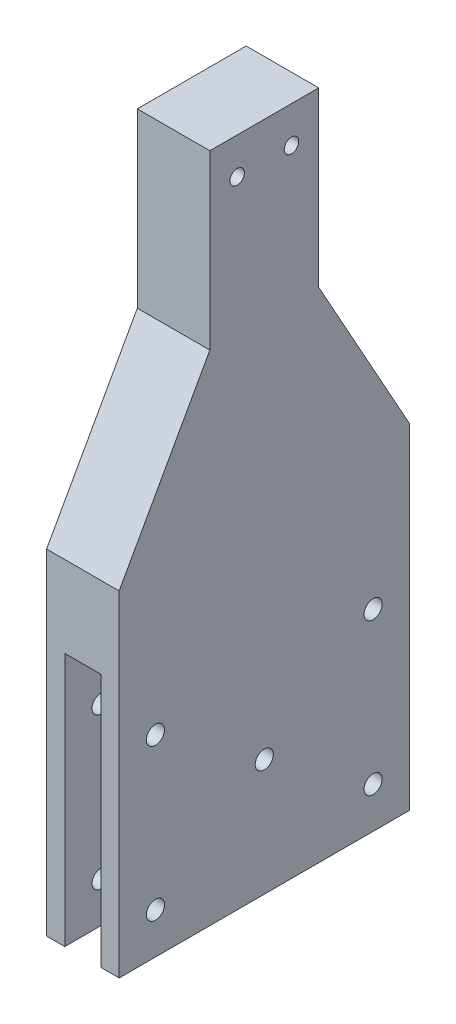
from build123d import *

# Parameters (mm, degrees)
SUPPORT_BALISE_W                           = 20
SUPPORT_BALISE_H                           = 350
SUPPORT_BALISE_BOSSAGE_DEPTH               = 80
ESQUISSE3_W                                = 80
ESQUISSE3_H                                = 80
SUPPORT_CHEVAL_ENLEVEMENT_DE_MATIERE_DEPTH = 10
ESQUISSE8_W                                = 10
ESQUISSE8_H                                = 70
SUPPORT_CHEVAL_DEPTH                       = 80
VIS_REACH                                  = 376.466
SERRAGE_VIS_R                              = 2.5
VIS_DIRECTION_2_DEPTH                      = 375.466286867
ENL_V_MAT_EXTRU_5_DEPTH                    = 20
POUR_IMPRESSION_R                          = 15
FIXATION_POUR_ASSEMBLAGE_R                 = 2
VIS_POUR_ASSEMBLAGE_DEPTH                  = 20
ESQUISSE13_R                               = 2
ENL_V_MAT_EXTRU_10_DEPTH                   = 463


with BuildPart() as part:
    # Support Balise → Support balise bossage (new body)
    with BuildSketch(Plane.XY):
        with Locations((10, 175)):
            Rectangle(SUPPORT_BALISE_W, SUPPORT_BALISE_H)
    extrude(amount=SUPPORT_BALISE_BOSSAGE_DEPTH)

    # Esquisse3 → Support Cheval enlevement de matiere (add)
    with BuildSketch(Plane(origin=(0, 350, 0), x_dir=(1, 0, 0), z_dir=(0, 1, 0))):
        with Locations((-20, -40)):
            Rectangle(ESQUISSE3_W, ESQUISSE3_H)
    extrude(amount=SUPPORT_CHEVAL_ENLEVEMENT_DE_MATIERE_DEPTH)

    # Esquisse8 → Support Cheval (cut)
    with BuildSketch(Plane.XY.offset(80)):
        with Locations((10, 35)):
            Rectangle(ESQUISSE8_W, ESQUISSE8_H)
    extrude(amount=-SUPPORT_CHEVAL_DEPTH, mode=Mode.SUBTRACT)

    # Vis: up to this face of the body (flat: up to its plane)
    vis_end = Plane(part.part.faces().sort_by_distance((0, 175, 40))[0])
    # Serrage vis → Vis (cut, up to the picked face)
    with BuildSketch(Plane(origin=(5, 0, 0), x_dir=(0, 0, -1), z_dir=(1, 0, 0)), mode=Mode.PRIVATE) as vis_sk1:
        with Locations((-70, 11.284552026)):
            Circle(SERRAGE_VIS_R)
    vis_tool1 = split(extrude(vis_sk1.sketch, amount=-VIS_REACH, mode=Mode.PRIVATE), bisect_by=vis_end, keep=Keep.BOTH, mode=Mode.PRIVATE)
    # Serrage vis → Vis (cut, up to the picked face)
    with BuildSketch(Plane(origin=(5, 0, 0), x_dir=(0, 0, -1), z_dir=(1, 0, 0)), mode=Mode.PRIVATE) as vis_sk2:
        with Locations((-70, 53.057184379)):
            Circle(SERRAGE_VIS_R)
    vis_tool2 = split(extrude(vis_sk2.sketch, amount=-VIS_REACH, mode=Mode.PRIVATE), bisect_by=vis_end, keep=Keep.BOTH, mode=Mode.PRIVATE)
    # Serrage vis → Vis (cut, up to the picked face)
    with BuildSketch(Plane(origin=(5, 0, 0), x_dir=(0, 0, -1), z_dir=(1, 0, 0)), mode=Mode.PRIVATE) as vis_sk3:
        with Locations((-10, 53.057184379)):
            Circle(SERRAGE_VIS_R)
    vis_tool3 = split(extrude(vis_sk3.sketch, amount=-VIS_REACH, mode=Mode.PRIVATE), bisect_by=vis_end, keep=Keep.BOTH, mode=Mode.PRIVATE)
    # Serrage vis → Vis (cut, up to the picked face)
    with BuildSketch(Plane(origin=(5, 0, 0), x_dir=(0, 0, -1), z_dir=(1, 0, 0)), mode=Mode.PRIVATE) as vis_sk4:
        with Locations((-10, 11.284552026)):
            Circle(SERRAGE_VIS_R)
    vis_tool4 = split(extrude(vis_sk4.sketch, amount=-VIS_REACH, mode=Mode.PRIVATE), bisect_by=vis_end, keep=Keep.BOTH, mode=Mode.PRIVATE)
    # Serrage vis → Vis (cut, up to the picked face)
    with BuildSketch(Plane(origin=(5, 0, 0), x_dir=(0, 0, -1), z_dir=(1, 0, 0)), mode=Mode.PRIVATE) as vis_sk5:
        with Locations((-40, 32.170868202)):
            Circle(SERRAGE_VIS_R)
    vis_tool5 = split(extrude(vis_sk5.sketch, amount=-VIS_REACH, mode=Mode.PRIVATE), bisect_by=vis_end, keep=Keep.BOTH, mode=Mode.PRIVATE)
    add(vis_tool1.solids().sort_by(Axis((5, 11.284552, 70), (-1, 0, 0)))[0], mode=Mode.SUBTRACT)
    add(vis_tool2.solids().sort_by(Axis((5, 53.057184, 70), (-1, 0, 0)))[0], mode=Mode.SUBTRACT)
    add(vis_tool3.solids().sort_by(Axis((5, 53.057184, 10), (-1, 0, 0)))[0], mode=Mode.SUBTRACT)
    add(vis_tool4.solids().sort_by(Axis((5, 11.284552, 10), (-1, 0, 0)))[0], mode=Mode.SUBTRACT)
    add(vis_tool5.solids().sort_by(Axis((5, 32.170868, 40), (-1, 0, 0)))[0], mode=Mode.SUBTRACT)

    # Serrage vis → Vis direction 2 (cut)
    with BuildSketch(Plane(origin=(5, 0, 0), x_dir=(0, 0, -1), z_dir=(1, 0, 0))):
        with Locations((-70, 11.284552026)):
            Circle(SERRAGE_VIS_R)
        with Locations((-70, 53.057184379)):
            Circle(SERRAGE_VIS_R)
        with Locations((-10, 53.057184379)):
            Circle(SERRAGE_VIS_R)
        with Locations((-10, 11.284552026)):
            Circle(SERRAGE_VIS_R)
        with Locations((-40, 32.170868202)):
            Circle(SERRAGE_VIS_R)
    extrude(amount=VIS_DIRECTION_2_DEPTH, mode=Mode.SUBTRACT)

    # Design → Enlèv. mat.-Extru.5 (cut)
    with BuildSketch(Plane(origin=(20, 0, 0), x_dir=(0, 0, -1), z_dir=(1, 0, 0))):
        Polygon((-55, 315), (-80, 360), (-80, 92.406088827), (-55, 137.406088827), align=None)
        Polygon((0, 92.406088827), (0, 360), (-25, 315), (-25, 137.406088827), align=None)
    extrude(amount=-ENL_V_MAT_EXTRU_5_DEPTH, mode=Mode.SUBTRACT)

    # Pour Impression
    # the kernel refuses this fillet: 15 mm, written as the material it adds along each edge
    with BuildSketch(Plane(origin=(0, 392.780897855, -18.211609919), x_dir=(1, 0, 0), z_dir=(0, -0.8741572761215375, 0.48564293117863266))) as pour_impression_piece_1_section:
        with BuildLine():
            CenterArc((POUR_IMPRESSION_R, -POUR_IMPRESSION_R), POUR_IMPRESSION_R, 90, 90)
            Line((0, -POUR_IMPRESSION_R), (0, 0))
            Line((0, 0), (POUR_IMPRESSION_R, 0))
        make_face()
    pour_impression_piece_1 = extrude(amount=86.439589046, mode=Mode.PRIVATE)
    pour_impression_piece_1 = split(pour_impression_piece_1, bisect_by=Plane(origin=(4.741525676, 350, 2.029382941), z_dir=(0, 1, 0)), keep=Keep.TOP, mode=Mode.PRIVATE)
    pour_impression_piece_1 = split(pour_impression_piece_1, bisect_by=Plane(origin=(4.741525676, 353.652889294, 0), z_dir=(0, 0, 1)), keep=Keep.TOP, mode=Mode.PRIVATE)
    add(pour_impression_piece_1)
    with BuildSketch(Plane(origin=(0, 317.219102145, 56.232834525), x_dir=(1, 0, 0), z_dir=(0, 0.8741572761215377, 0.4856429311786322))) as pour_impression_piece_2_section:
        with BuildLine():
            CenterArc((POUR_IMPRESSION_R, -POUR_IMPRESSION_R), POUR_IMPRESSION_R, 90, 90)
            Line((0, -POUR_IMPRESSION_R), (0, 0))
            Line((0, 0), (POUR_IMPRESSION_R, 0))
        make_face()
    pour_impression_piece_2 = extrude(amount=86.439589046, mode=Mode.PRIVATE)
    pour_impression_piece_2 = split(pour_impression_piece_2, bisect_by=Plane(origin=(4.741525676, 350, 77.970617059), z_dir=(0, 1, 0)), keep=Keep.TOP, mode=Mode.PRIVATE)
    pour_impression_piece_2 = split(pour_impression_piece_2, bisect_by=Plane(origin=(4.741525676, 353.652889294, 80), z_dir=(0, 0, -1)), keep=Keep.TOP, mode=Mode.PRIVATE)
    add(pour_impression_piece_2)

    # Fixation pour assemblage → Vis pour Assemblage (cut)
    with BuildSketch(Plane(origin=(20, 0, 0), x_dir=(0, 0, -1), z_dir=(1, 0, 0))):
        with Locations((-47.5, 195)):
            Circle(FIXATION_POUR_ASSEMBLAGE_R)
        with Locations((-32.5, 195)):
            Circle(FIXATION_POUR_ASSEMBLAGE_R)
        with Locations((-32.5, 175)):
            Circle(FIXATION_POUR_ASSEMBLAGE_R)
        with Locations((-47.5, 175)):
            Circle(FIXATION_POUR_ASSEMBLAGE_R)
    extrude(amount=-VIS_POUR_ASSEMBLAGE_DEPTH, mode=Mode.SUBTRACT)

    # Esquisse13 → Enlèv. mat.-Extru.10 (cut)
    # profile 1 of 2: a face of its own
    with BuildSketch(Plane(origin=(20, 0, 0), x_dir=(0, 0, -1), z_dir=(1, 0, 0))):
        Polygon((-174.897376457, 185), (-55, 185), (-55, 315), (-80, 360), (0, 360), (-25, 315), (-25, 185), (122.454281653, 185), (122.454281653, 440.420380727), (-174.897376457, 440.420380727), align=None)
    # profile 2 of 2: a face of its own
    with BuildSketch(Plane(origin=(20, 0, 0), x_dir=(0, 0, -1), z_dir=(1, 0, 0))):
        Polygon((-55, 315), (-55, 185), (-25, 185), (-25, 315), (0, 360), (-80, 360), align=None)
        with Locations((-47.5, 195)):
            Circle(ESQUISSE13_R, mode=Mode.SUBTRACT)
        with Locations((-32.5, 195)):
            Circle(ESQUISSE13_R, mode=Mode.SUBTRACT)
    extrude(amount=-ENL_V_MAT_EXTRU_10_DEPTH, mode=Mode.SUBTRACT)


solid = part.part
